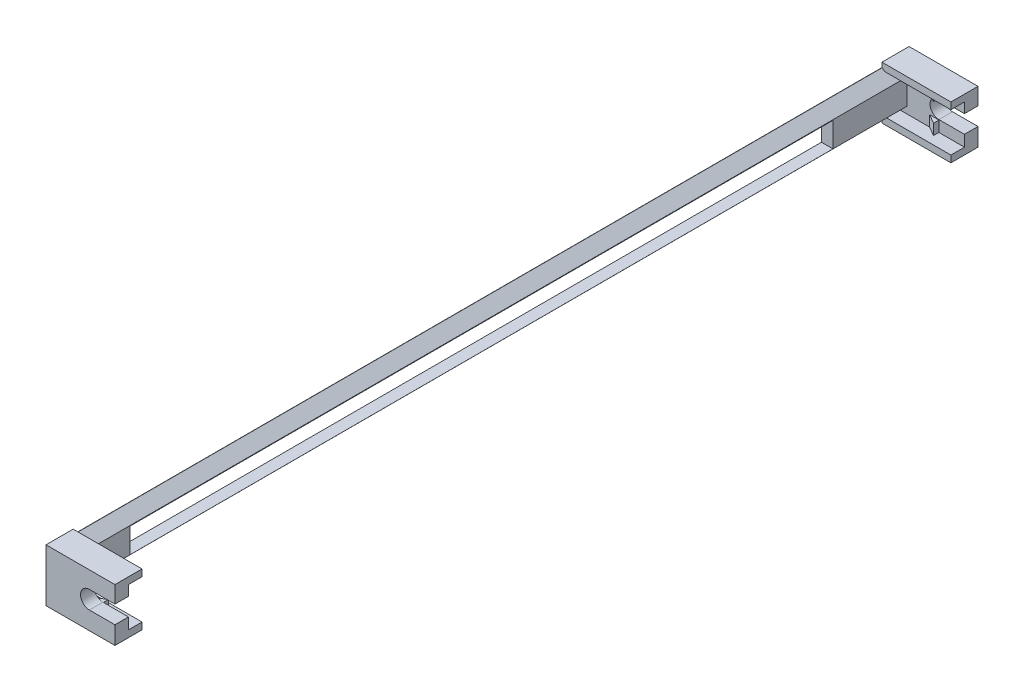
from build123d import *

# Parameters (mm, degrees)
EXTRUDE_START              = 0.3
EXTRUDE_1_DEPTH            = 4
EXTRUDE_2_DEPTH            = 4
SKETCH_3_W                 = 254.6
SKETCH_3_H                 = 12.878514778
EXTRUDE_3_DEPTH            = 3.4
CUT_EXTRUDE_1_REACH        = 253.212
SKETCH_4_W                 = 207.3
SKETCH_4_H                 = 7.3
SKETCH_5_W                 = 2.745808793
SKETCH_5_H                 = 3.85924733
SKETCH_5_H_2               = 3.447603815
EXTRUDE_4_DEPTH            = 2
SKETCH_6_W                 = 2.745808793
SKETCH_6_H                 = 3.85924733
SKETCH_6_H_2               = 3.447603815
EXTRUDE_5_DEPTH            = 2
CHAMFER_1_SIZE             = 3.464101615
CHAMFER_1_SIZE_2           = 2
CHAMFER_2_SIZE             = 2.7
CHAMFER_2_SIZE2            = 3.334222323
EXTRUDE_START_2            = -4
SKETCH_7_W                 = 20.333516096
SKETCH_7_H                 = 2
EXTRUDE_6_DEPTH            = 8
EXTRUDE_7_DEPTH            = 4
EXTRUDE_7_DEPTH_BACK       = 4
CUT_EXTRUDE_1_2_DEPTH      = 256.045082384
CUT_EXTRUDE_1_2_DEPTH_BACK = 1
SKETCH_9_W                 = 12.804262888
SKETCH_9_H                 = 1


with BuildPart() as part:
    # 草图1 → 凸台-拉伸1 (new body)
    with BuildSketch(Plane.XY.offset(EXTRUDE_START)):
        with BuildLine():
            Line((7.529253208, 6.254669476), (-12.804262888, 6.254669476))
            Line((-12.804262888, 6.254669476), (-12.804262888, -6.623845302))
            Line((-12.804262888, -6.623845302), (7.529253208, -6.623845302))
            Line((7.529253208, -6.623845302), (7.529253208, -2.63))
            Line((7.529253208, -2.63), (0, -2.63))
            ThreePointArc((0, -2.63), (-2.63, 0), (0, 2.63))
            Line((0, 2.63), (7.529253208, 2.63))
            Line((7.529253208, 2.63), (7.529253208, 6.254669476))
        make_face()
    extrude(amount=EXTRUDE_1_DEPTH)



with BuildPart() as body_2:
    # 草图2 → 凸台-拉伸2 (new body)
    with BuildSketch(Plane(origin=(0, 0, -246.3), x_dir=(-1, 0, 0), z_dir=(0, 0, -1))):
        with BuildLine():
            Line((-7.529253208, 6.254669476), (-7.529253208, 2.63))
            Line((-7.529253208, 2.63), (0, 2.63))
            ThreePointArc((0, 2.63), (2.63, 0), (0, -2.63))
            Line((0, -2.63), (-7.529253208, -2.63))
            Line((-7.529253208, -2.63), (-7.529253208, -6.623845302))
            Line((-7.529253208, -6.623845302), (12.804262888, -6.623845302))
            Line((12.804262888, -6.623845302), (12.804262888, 6.254669476))
            Line((12.804262888, 6.254669476), (-7.529253208, 6.254669476))
        make_face()
    extrude(amount=EXTRUDE_2_DEPTH)


with BuildPart() as part_1:
    add(part.part)

    add(body_2.part)  # 凸台-拉伸3 merges body 2
    # 草图3 → 凸台-拉伸3 (add)
    with BuildSketch(Plane.ZY.offset(12.804262888)):
        with Locations((-123, -0.184587913)):
            Rectangle(SKETCH_3_W, SKETCH_3_H)
    extrude(amount=-EXTRUDE_3_DEPTH)

    # 草图4 → Cut-Extrude 1 (cut, up to next)
    with BuildSketch(Plane.ZY.offset(12.804262888), mode=Mode.PRIVATE) as cut_extrude_1_sk1:
        with Locations((-120.8, -0.25)):
            Rectangle(SKETCH_4_W, SKETCH_4_H)
    cut_extrude_1_tool1 = extrude(cut_extrude_1_sk1.sketch, amount=-CUT_EXTRUDE_1_REACH, mode=Mode.PRIVATE) & part_1.part
    add(cut_extrude_1_tool1.solids().sort_by_distance((-12.804263, -0.25, -120.8))[0], mode=Mode.SUBTRACT)

    # 草图5 → 凸台-拉伸4 (add)
    with BuildSketch(Plane.XY.offset(-246.3)):
        with Locations((-1.372904397, -4.694221637)):
            Rectangle(SKETCH_5_W, SKETCH_5_H)
        with Locations((-1.372904397, 4.530867568)):
            Rectangle(SKETCH_5_W, SKETCH_5_H_2)
    extrude(amount=EXTRUDE_4_DEPTH)

    # 草图6 → 凸台-拉伸5 (add)
    with BuildSketch(Plane(origin=(0, 0, 0.3), x_dir=(-1, 0, 0), z_dir=(0, 0, -1))):
        with Locations((1.372904397, -4.694221637)):
            Rectangle(SKETCH_6_W, SKETCH_6_H)
        with Locations((1.372904397, 4.530867568)):
            Rectangle(SKETCH_6_W, SKETCH_6_H_2)
    extrude(amount=EXTRUDE_5_DEPTH)

    # 倒角1
    # the kernel refuses this chamfer: 3.464101615, 2 mm, written as the material it takes off along each edge
    with BuildSketch(Plane(origin=(-2.745808793, 15.216597417, -244.3), x_dir=(0.9998132206222079, 0, 0.01932676561270368), z_dir=(0, -1, 0))) as chamfer_1_piece_1_section:
        Polygon((CHAMFER_1_SIZE * 0.999813220662, -CHAMFER_1_SIZE * 0.0193267656135), (-CHAMFER_1_SIZE_2 * 0.0193267656127, -CHAMFER_1_SIZE_2 * 0.999813220622), (0, 0), align=None)
    chamfer_1_piece_1 = extrude(amount=21.371459697, mode=Mode.PRIVATE)
    chamfer_1_piece_1 = split(chamfer_1_piece_1, bisect_by=Plane(origin=(-1.581226814, 4.530867568, -246.3), z_dir=(0, 0, 1)), keep=Keep.TOP, mode=Mode.PRIVATE)
    add(chamfer_1_piece_1, mode=Mode.SUBTRACT)
    with BuildSketch(Plane(origin=(-2.745808793, -15.585773243, -244.3), x_dir=(-0.057893862402670956, 0, -0.9983227437537926), z_dir=(0, 1, 0))) as chamfer_1_piece_2_section:
        Polygon((CHAMFER_1_SIZE_2 * 0.998322743754, -CHAMFER_1_SIZE_2 * 0.0578938624027), (-CHAMFER_1_SIZE * 0.057893862405, -CHAMFER_1_SIZE * 0.998322743793), (0, 0), align=None)
    chamfer_1_piece_2 = extrude(amount=21.783103212, mode=Mode.PRIVATE)
    chamfer_1_piece_2 = split(chamfer_1_piece_2, bisect_by=Plane(origin=(-1.581226814, -4.694221637, -246.3), z_dir=(0, 0, 1)), keep=Keep.TOP, mode=Mode.PRIVATE)
    add(chamfer_1_piece_2, mode=Mode.SUBTRACT)
    with BuildSketch(Plane(origin=(-2.745808793, 6.197329969, -1.7), x_dir=(-0.057893862402671255, 0, 0.9983227437537926), z_dir=(0, -1, 0))) as chamfer_1_piece_3_section:
        Polygon((CHAMFER_1_SIZE_2 * 0.998322743754, -CHAMFER_1_SIZE_2 * 0.0578938624027), (-CHAMFER_1_SIZE * 0.057893862405, -CHAMFER_1_SIZE * 0.998322743793), (0, 0), align=None)
    chamfer_1_piece_3 = extrude(amount=21.783103212, mode=Mode.PRIVATE)
    chamfer_1_piece_3 = split(chamfer_1_piece_3, bisect_by=Plane(origin=(-1.581226814, -4.694221637, 0.3), z_dir=(0, 0, -1)), keep=Keep.TOP, mode=Mode.PRIVATE)
    add(chamfer_1_piece_3, mode=Mode.SUBTRACT)
    with BuildSketch(Plane(origin=(-2.745808793, 15.216597417, -1.7), x_dir=(-0.057893862402671255, 0, 0.9983227437537926), z_dir=(0, -1, 0))) as chamfer_1_piece_4_section:
        Polygon((CHAMFER_1_SIZE_2 * 0.998322743754, -CHAMFER_1_SIZE_2 * 0.0578938624027), (-CHAMFER_1_SIZE * 0.057893862405, -CHAMFER_1_SIZE * 0.998322743793), (0, 0), align=None)
    chamfer_1_piece_4 = extrude(amount=21.371459697, mode=Mode.PRIVATE)
    chamfer_1_piece_4 = split(chamfer_1_piece_4, bisect_by=Plane(origin=(-1.581226814, 4.530867568, 0.3), z_dir=(0, 0, -1)), keep=Keep.TOP, mode=Mode.PRIVATE)
    add(chamfer_1_piece_4, mode=Mode.SUBTRACT)

    # 倒角2
    chamfer_2_edges = [part_1.edges().sort_by_distance(p)[0] for p in [
        (-9.404262888, 6.254669476, -123),
        (-9.404262888, -6.623845302, -123),
    ]]
    chamfer_2_side = [part_1.faces().sort_by_distance(p)[0] for p in [
        (-9.404262888, -4.154484734, -123),
    ]]
    chamfer(chamfer_2_edges, length=CHAMFER_2_SIZE, length2=CHAMFER_2_SIZE2, reference=chamfer_2_side[0])

    # 草图7 → 凸台-拉伸6 (add)
    with BuildSketch(Plane.XY.offset(-246.3).offset(EXTRUDE_START_2)):
        with Locations((-2.63750484, -6.93)):
            Rectangle(SKETCH_7_W, SKETCH_7_H)
        with Locations((-2.63750484, 6.63)):
            Rectangle(SKETCH_7_W, SKETCH_7_H)
    extrude(amount=EXTRUDE_6_DEPTH)

    # 草图8 → 凸台-拉伸7 (add, two sides: drawn at the far end of the back side and taken through both)
    with BuildSketch(Plane(origin=(0, 0, 0.3), x_dir=(-1, 0, 0), z_dir=(0, 0, -1)).offset(-EXTRUDE_7_DEPTH_BACK)):
        Polygon((12.738485211, -6.623845302), (11.88165762, -5.93), (-7.529253208, -5.93), (-7.529253208, -7.93), (12.804262888, -7.93), (12.804262888, -6.623845302), align=None)
        Polygon((12.738485211, 6.254669476), (12.804262888, 6.254669476), (12.804262888, 7.63), (-7.529253208, 7.63), (-7.529253208, 5.63), (11.967082651, 5.63), align=None)
    extrude(amount=EXTRUDE_7_DEPTH + EXTRUDE_7_DEPTH_BACK)

    # 草图9 → Cut-Extrude 1 2 (cut, two sides: drawn at the far end of the back side and taken through both)
    with BuildSketch(Plane(origin=(0, 0, -250.3), x_dir=(-1, 0, 0), z_dir=(0, 0, -1)).offset(-CUT_EXTRUDE_1_2_DEPTH_BACK)):
        with Locations((6.402131444, 0)):
            Rectangle(SKETCH_9_W, SKETCH_9_H)
    extrude(amount=CUT_EXTRUDE_1_2_DEPTH + CUT_EXTRUDE_1_2_DEPTH_BACK, mode=Mode.SUBTRACT)


solid = part_1.part
